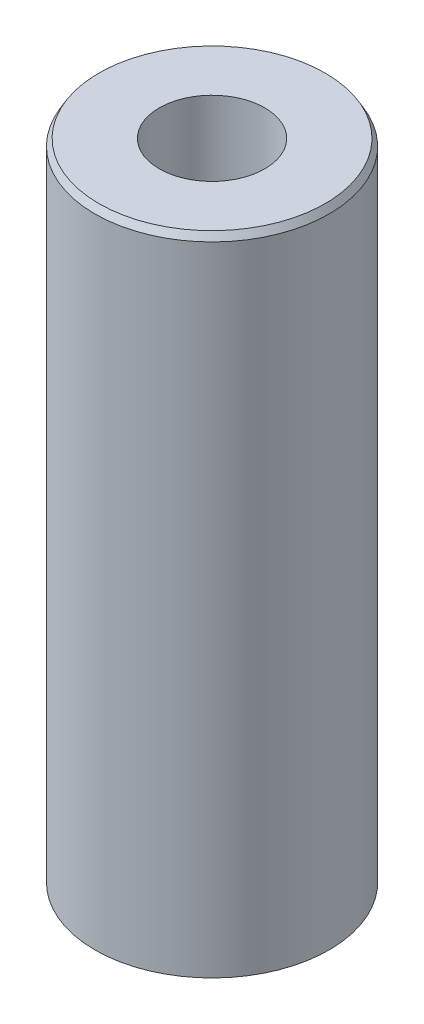
from build123d import *
from OCP.BRepFilletAPI import BRepFilletAPI_MakeChamfer

# Parameters (mm, degrees)
SKETCH1_R           = 57.5
BOSS_EXTRUDE1_DEPTH = 318.297930586
SKETCH2_R           = 25.928335976
CUT_EXTRUDE1_DEPTH  = 329.521038314
CHAMFER1_SIZE       = 3.402547971
CHAMFER1_SIZE2      = 1.964461987


with BuildPart() as part:
    # Sketch1 → Boss-Extrude1 (new body)
    with BuildSketch(Plane(origin=(0, 0, 0), x_dir=(1, 0, 0), z_dir=(0, 1, 0))):
        Circle(SKETCH1_R)
    extrude(amount=BOSS_EXTRUDE1_DEPTH)

    # Sketch2 → Cut-Extrude1 (cut, through all)
    with BuildSketch(Plane(origin=(0, 0, 0), x_dir=(1, 0, 0), z_dir=(0, 1, 0))):
        Circle(SKETCH2_R)
    extrude(amount=CUT_EXTRUDE1_DEPTH, mode=Mode.SUBTRACT)

    # Chamfer1: one chamfer whose edges measure the first distance from different faces: ONE call of the kernel's chamfer builder (chamfer() names one face for all edges)
    chamfer1_edges_1 = [part.edges().sort_by_distance(p)[0] for p in [
        (-57.5, 318.297930586, 0),
    ]]
    chamfer1_side_1 = [part.faces().sort_by_distance(p)[0] for p in [
        (-57.5, 159.148965293, 0),
    ]]
    chamfer1_edges_2 = [part.edges().sort_by_distance(p)[0] for p in [
        (-57.5, 0, 0),
    ]]
    chamfer1_side_2 = [part.faces().sort_by_distance(p)[0] for p in [
        (-55.873654403, 0, 0),
    ]]
    chamfer1 = BRepFilletAPI_MakeChamfer(part.part.solid().wrapped)
    for e in chamfer1_edges_1:
        chamfer1.Add(CHAMFER1_SIZE, CHAMFER1_SIZE2, e.wrapped, chamfer1_side_1[0].wrapped)  # the first distance lies on this face
    for e in chamfer1_edges_2:
        chamfer1.Add(CHAMFER1_SIZE, CHAMFER1_SIZE2, e.wrapped, chamfer1_side_2[0].wrapped)  # the first distance lies on this face
    add(Compound.cast(chamfer1.Shape()), mode=Mode.REPLACE)


solid = part.part
